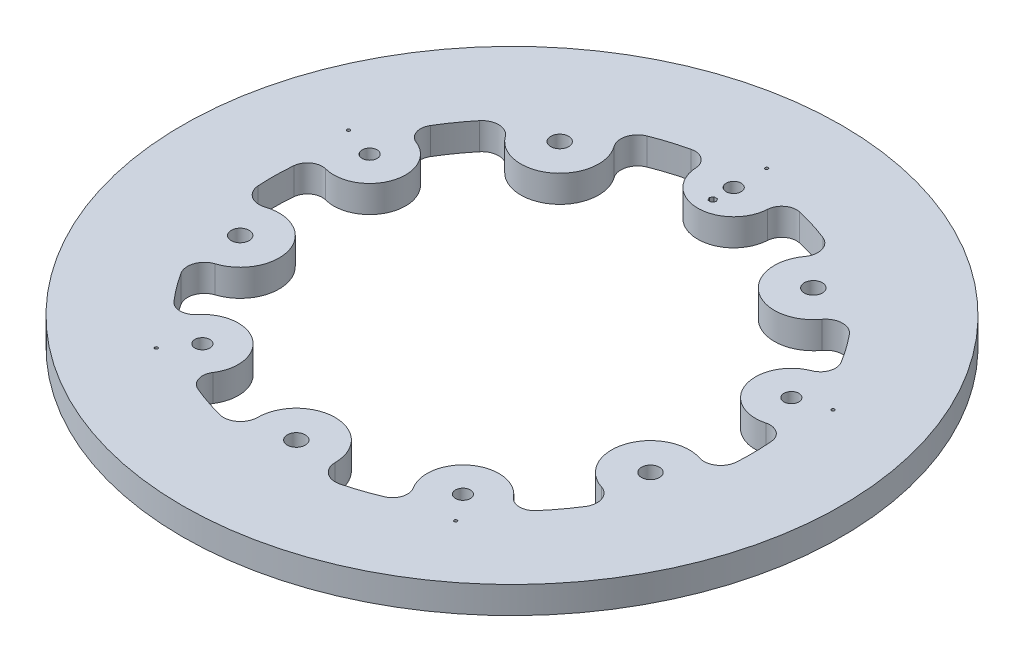
from build123d import *

# Parameters (mm, degrees)
SKETCH2_R           = 110
SKETCH2_R_2         = 2
SKETCH2_R_3         = 3
BOSS_EXTRUDE1_DEPTH = 9
SKETCH4_R           = 2.5
CUT_EXTRUDE1_DEPTH  = 156.823618235
CUT_EXTRUDE2_DEPTH  = 156.823618235
SKETCH6_R           = 0.5
CUT_EXTRUDE3_DEPTH  = 156.823618235


with BuildPart() as part:
    # Sketch2 → Boss-Extrude1 (new body)
    with BuildSketch(Plane(origin=(0, 0, 0), x_dir=(1, 0, 0), z_dir=(0, 1, 0))):
        Circle(SKETCH2_R)
        with Locations((0, 74)):
            Circle(SKETCH2_R_2, mode=Mode.SUBTRACT)
        with Locations((70.378182206, 22.867257584)):
            Circle(SKETCH2_R_2, mode=Mode.SUBTRACT)
        with Locations((43.49610867, -59.867257584)):
            Circle(SKETCH2_R_2, mode=Mode.SUBTRACT)
        with Locations((-43.49610867, -59.867257584)):
            Circle(SKETCH2_R_2, mode=Mode.SUBTRACT)
        with Locations((-70.378182206, 22.867257584)):
            Circle(SKETCH2_R_2, mode=Mode.SUBTRACT)
        with Locations((0, -72)):
            Circle(SKETCH2_R_3, mode=Mode.SUBTRACT)
        with Locations((-68.476069173, -22.249223595)):
            Circle(SKETCH2_R_3, mode=Mode.SUBTRACT)
        with Locations((-42.320538165, 58.249223595)):
            Circle(SKETCH2_R_3, mode=Mode.SUBTRACT)
        with Locations((42.320538165, 58.249223595)):
            Circle(SKETCH2_R_3, mode=Mode.SUBTRACT)
        with Locations((68.476069173, -22.249223595)):
            Circle(SKETCH2_R_3, mode=Mode.SUBTRACT)
        with BuildLine():
            ThreePointArc((-18.105238982, 77.924324324), (-23.772563309, 76.386289567), (-29.311797662, 74.436674548))
            ThreePointArc((-29.311797662, 74.436674548), (-32.653398245, 70.774561882), (-31.803317238, 65.890431875))
            ThreePointArc((-31.803317238, 65.890431875), (-34.679329885, 47.732002668), (-52.837759092, 50.608015315))
            ThreePointArc((-52.837759092, 50.608015315), (-57.220153284, 52.925769571), (-61.735640767, 50.879373611))
            ThreePointArc((-61.735640767, 50.879373611), (-65.301552386, 46.213712857), (-68.515609894, 41.299046004))
            ThreePointArc((-68.515609894, 41.299046004), (-68.964800278, 37.101160663), (-66.040677784, 34.055915028))
            ThreePointArc((-66.040677784, 34.055915028), (-58.96550401, 19.159053651), (-73.445595254, 11.265922437))
            ThreePointArc((-73.445595254, 11.265922437), (-77.601210519, 10.521023043), (-79.705262959, 6.860834978))
            ThreePointArc((-79.705262959, 6.860834978), (-79.99380451, 0.99561037), (-79.851327994, -4.87497873))
            ThreePointArc((-79.851327994, -4.87497873), (-77.401063247, -9.184684789), (-72.4932901, -9.885488883))
            ThreePointArc((-72.4932901, -9.885488883), (-56.112334461, -18.232002668), (-64.458848246, -34.612958307))
            ThreePointArc((-64.458848246, -34.612958307), (-68.017397816, -38.064637406), (-67.466521973, -42.991492331))
            ThreePointArc((-67.466521973, -42.991492331), (-64.131142201, -47.824644275), (-60.450214656, -52.400110191))
            ThreePointArc((-60.450214656, -52.400110191), (-56.59659591, -54.124533543), (-52.796791661, -52.284560445))
            ThreePointArc((-52.796791661, -52.284560445), (-36.442685642, -50.159053651), (-33.410466041, -66.369550469))
            ThreePointArc((-33.410466041, -66.369550469), (-33.986180358, -70.551962018), (-31.155322609, -73.684095116))
            ThreePointArc((-31.155322609, -73.684095116), (-25.666326768, -75.770968519), (-20.039037085, -77.449577098))
            ThreePointArc((-20.039037085, -77.449577098), (-15.183089607, -76.451009257), (-13, -72))
            ThreePointArc((-13, -72), (0, -59), (13, -72))
            ThreePointArc((13, -72), (15.183089607, -76.451009257), (20.039037085, -77.449577098))
            ThreePointArc((20.039037085, -77.449577098), (25.666326768, -75.770968519), (31.155322609, -73.684095116))
            ThreePointArc((31.155322609, -73.684095116), (33.986180358, -70.551962018), (33.410466041, -66.369550469))
            ThreePointArc((33.410466041, -66.369550469), (36.442685642, -50.159053651), (52.796791661, -52.284560445))
            ThreePointArc((52.796791661, -52.284560445), (56.59659591, -54.124533543), (60.450214656, -52.400110191))
            ThreePointArc((60.450214656, -52.400110191), (64.131142201, -47.824644275), (67.466521973, -42.991492331))
            ThreePointArc((67.466521973, -42.991492331), (68.017397816, -38.064637406), (64.458848246, -34.612958307))
            ThreePointArc((64.458848246, -34.612958307), (56.112334461, -18.232002668), (72.4932901, -9.885488883))
            ThreePointArc((72.4932901, -9.885488883), (77.401063247, -9.184684789), (79.851327994, -4.87497873))
            ThreePointArc((79.851327994, -4.87497873), (79.99380451, 0.99561037), (79.705262959, 6.860834978))
            ThreePointArc((79.705262959, 6.860834978), (77.601210519, 10.521023043), (73.445595254, 11.265922437))
            ThreePointArc((73.445595254, 11.265922437), (58.96550401, 19.159053651), (66.040677784, 34.055915028))
            ThreePointArc((66.040677784, 34.055915028), (68.964800278, 37.101160663), (68.515609894, 41.299046004))
            ThreePointArc((68.515609894, 41.299046004), (65.301552386, 46.213712857), (61.735640767, 50.879373611))
            ThreePointArc((61.735640767, 50.879373611), (57.220153284, 52.925769571), (52.837759092, 50.608015315))
            ThreePointArc((52.837759092, 50.608015315), (34.679329885, 47.732002668), (31.803317238, 65.890431875))
            ThreePointArc((31.803317238, 65.890431875), (32.653398245, 70.774561882), (29.311797662, 74.436674548))
            ThreePointArc((29.311797662, 74.436674548), (23.772563309, 76.386289567), (18.105238982, 77.924324324))
            ThreePointArc((18.105238982, 77.924324324), (13.974005311, 77.054311855), (11.98140815, 73.33227345))
            ThreePointArc((11.98140815, 73.33227345), (0, 62), (-11.98140815, 73.33227345))
            ThreePointArc((-11.98140815, 73.33227345), (-13.974005311, 77.054311855), (-18.105238982, 77.924324324))
        make_face(mode=Mode.SUBTRACT)
    extrude(amount=BOSS_EXTRUDE1_DEPTH)

    # Sketch4 → Cut-Extrude1 (cut, through all)
    with BuildSketch(Plane(origin=(0, 9, 0), x_dir=(1, 0, 0), z_dir=(0, 1, 0))):
        with Locations((0, 74)):
            Circle(SKETCH4_R)
        with Locations((70.378182206, 22.867257584)):
            Circle(SKETCH4_R)
        with Locations((43.49610867, -59.867257584)):
            Circle(SKETCH4_R)
        with Locations((-43.49610867, -59.867257584)):
            Circle(SKETCH4_R)
        with Locations((-70.378182206, 22.867257584)):
            Circle(SKETCH4_R)
    extrude(amount=-CUT_EXTRUDE1_DEPTH, mode=Mode.SUBTRACT)

    # Sketch5 → Cut-Extrude2 (cut, through all)
    with BuildSketch(Plane(origin=(0, 9, 0), x_dir=(1, 0, 0), z_dir=(0, 1, 0))):
        Polygon((0.577350269, 66), (1.154700538, 67), (0.577350269, 68), (-0.577350269, 68), (-1.154700538, 67), (-0.577350269, 66), align=None)
    extrude(amount=-CUT_EXTRUDE2_DEPTH, mode=Mode.SUBTRACT)

    # Sketch6 → Cut-Extrude3 (cut, through all)
    with BuildSketch(Plane(origin=(0, 9, 0), x_dir=(1, 0, 0), z_dir=(0, 1, 0))):
        with Locations((0, 85)):
            Circle(SKETCH6_R)
        with Locations((80.839803885, 26.266444522)):
            Circle(SKETCH6_R)
        with Locations((49.961746445, -68.766444522)):
            Circle(SKETCH6_R)
        with Locations((-49.961746445, -68.766444522)):
            Circle(SKETCH6_R)
        with Locations((-80.839803885, 26.266444522)):
            Circle(SKETCH6_R)
    extrude(amount=-CUT_EXTRUDE3_DEPTH, mode=Mode.SUBTRACT)


solid = part.part
